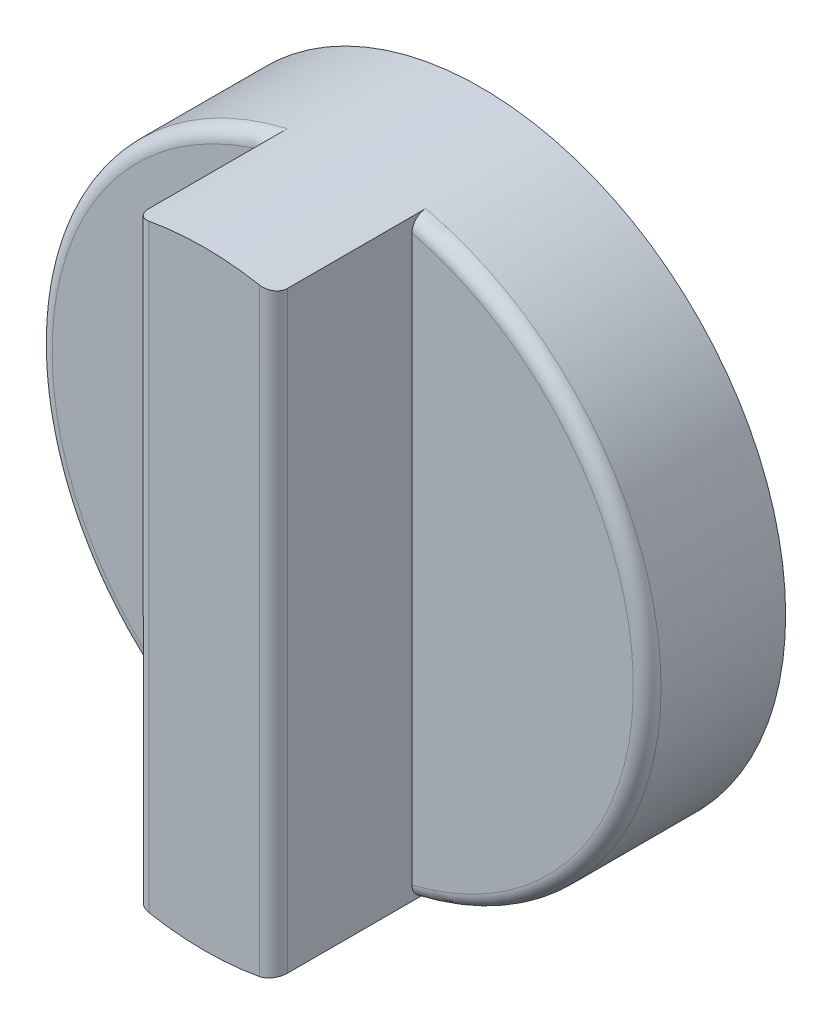
from build123d import *

# Parameters (mm, degrees)
ESQUISSE1_R        = 11
BOSS_EXTRU_1_DEPTH = 5
BOSS_EXTRU_2_DEPTH = 5
CONG_1_R           = 0.5
CONG_2_R           = 0.5


with BuildPart() as part:
    # Esquisse1 → Boss.-Extru.1 (new body)
    with BuildSketch(Plane.XY):
        Circle(ESQUISSE1_R)
    extrude(amount=BOSS_EXTRU_1_DEPTH)

    # Esquisse2 → Boss.-Extru.2 (add)
    with BuildSketch(Plane.XY.offset(5)):
        with BuildLine():
            Line((-2.5, 10.712142643), (-2.5, -10.712142643))
            ThreePointArc((-2.5, -10.712142643), (0, -11), (2.5, -10.712142643))
            Line((2.5, -10.712142643), (2.5, 10.712142643))
            ThreePointArc((2.5, 10.712142643), (0, 11), (-2.5, 10.712142643))
        make_face()
    extrude(amount=BOSS_EXTRU_2_DEPTH)

    # Congé1
    # the kernel refuses this fillet: 0.5 mm, written as the material it takes off along each edge
    with BuildSketch(Plane(origin=(0, 0, 5), x_dir=(1, 0, 0), z_dir=(0, -1, 0))) as cong_1_piece_1_section:
        with BuildLine():
            CenterArc((11 - CONG_1_R, -CONG_1_R), CONG_1_R, 0, 90)
            Line((11 - CONG_1_R, 0), (11, 0))
            Line((11, 0), (11, -CONG_1_R))
        make_face()
    cong_1_piece_1 = revolve(axis=Axis((0, 0, 5), (0, 0, 1)), revolution_arc=83.376232782, mode=Mode.PRIVATE)
    cong_1_piece_1 = split(cong_1_piece_1, bisect_by=Plane(origin=(2.5, 6.750657891, 4.860453912), z_dir=(1, 0, 0)), keep=Keep.TOP, mode=Mode.PRIVATE)
    add(cong_1_piece_1, mode=Mode.SUBTRACT)
    with BuildSketch(Plane(origin=(0, 0, 5), x_dir=(-0.11524991416990704, 0.9933365277104376, 0), z_dir=(0.9933365277104376, 0.11524991416990704, 0))) as cong_1_piece_2_section:
        with BuildLine():
            CenterArc((11 - CONG_1_R, -CONG_1_R), CONG_1_R, 0, 90)
            Line((11 - CONG_1_R, 0), (11, 0))
            Line((11, 0), (11, -CONG_1_R))
        make_face()
    cong_1_piece_2 = revolve(axis=Axis((0, 0, 5), (0, 0, 1)), revolution_arc=166.76392016, mode=Mode.PRIVATE)
    cong_1_piece_2 = split(cong_1_piece_2, bisect_by=Plane(origin=(-2.5, 0, 4.862247452), z_dir=(-1, 0, 0)), keep=Keep.TOP, mode=Mode.PRIVATE)
    add(cong_1_piece_2, mode=Mode.SUBTRACT)
    with BuildSketch(Plane(origin=(0, 0, 5), x_dir=(0.1153492077124676, -0.9933250023431938, 0), z_dir=(-0.9933250023431938, -0.1153492077124676, 0))) as cong_1_piece_3_section:
        with BuildLine():
            CenterArc((11 - CONG_1_R, -CONG_1_R), CONG_1_R, 0, 90)
            Line((11 - CONG_1_R, 0), (11, 0))
            Line((11, 0), (11, -CONG_1_R))
        make_face()
    cong_1_piece_3 = revolve(axis=Axis((0, 0, 5), (0, 0, 1)), revolution_arc=83.376232782, mode=Mode.PRIVATE)
    cong_1_piece_3 = split(cong_1_piece_3, bisect_by=Plane(origin=(2.5, -6.750657902, 4.860453931), z_dir=(1, 0, 0)), keep=Keep.TOP, mode=Mode.PRIVATE)
    add(cong_1_piece_3, mode=Mode.SUBTRACT)

    # Congé2
    cong_2_edges = [part.edges().sort_by_distance(p)[0] for p in [
        (-2.5, 0, 10),
        (2.5, 0, 10),
    ]]
    fillet(cong_2_edges, radius=CONG_2_R)


solid = part.part
